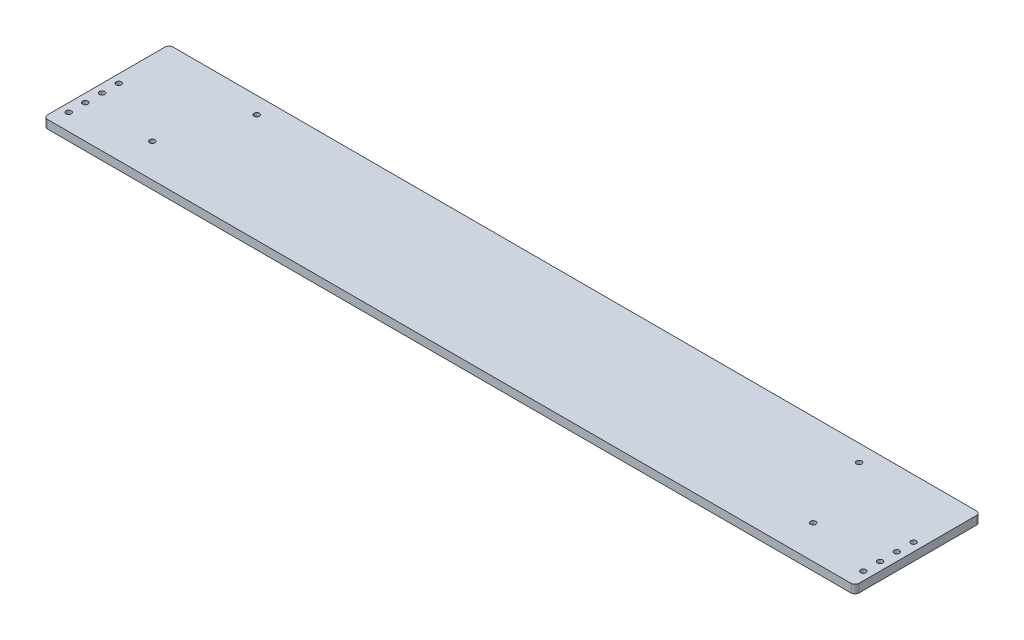
from build123d import *

# Parameters (mm, degrees)
SKETCH1_W           = 615.95
SKETCH1_H           = 95.25
SKETCH1_R           = 2.0193
BOSS_EXTRUDE1_DEPTH = 6.35
FILLET1_R           = 3.175
SKETCH2_R           = 2.0193
CUT_EXTRUDE1_DEPTH  = 312.700278713


with BuildPart() as part:
    # Sketch1 → Boss-Extrude1 (new body)
    with BuildSketch(Plane(origin=(0, 0, 0), x_dir=(1, 0, 0), z_dir=(0, 1, 0))):
        Rectangle(SKETCH1_W, SKETCH1_H)
        with Locations((-301.625, 3.175)):
            Circle(SKETCH1_R, mode=Mode.SUBTRACT)
        with Locations((-301.625, -9.525)):
            Circle(SKETCH1_R, mode=Mode.SUBTRACT)
        with Locations((-301.625, -22.225)):
            Circle(SKETCH1_R, mode=Mode.SUBTRACT)
        with Locations((-301.625, -34.925)):
            Circle(SKETCH1_R, mode=Mode.SUBTRACT)
        with Locations((301.625, -34.925)):
            Circle(SKETCH1_R, mode=Mode.SUBTRACT)
        with Locations((301.625, -22.225)):
            Circle(SKETCH1_R, mode=Mode.SUBTRACT)
        with Locations((301.625, -9.525)):
            Circle(SKETCH1_R, mode=Mode.SUBTRACT)
        with Locations((301.625, 3.175)):
            Circle(SKETCH1_R, mode=Mode.SUBTRACT)
    extrude(amount=BOSS_EXTRUDE1_DEPTH)

    # Fillet1
    fillet1_edges = [part.edges().sort_by_distance(p)[0] for p in [
        (307.975, 3.175, 47.625),
        (-307.975, 3.175, -47.625),
        (307.975, 3.175, -47.625),
        (-307.975, 3.175, 47.625),
    ]]
    fillet(fillet1_edges, radius=FILLET1_R)

    # Sketch2 → Cut-Extrude1 (cut, through all)
    with BuildSketch(Plane(origin=(0, 6.35, 0), x_dir=(1, 0, 0), z_dir=(0, 1, 0))):
        with Locations((-228.6, 34.925)):
            Circle(SKETCH2_R)
        with Locations((-250.825, -22.225)):
            Circle(SKETCH2_R)
        with Locations((250.825, -22.225)):
            Circle(SKETCH2_R)
        with Locations((228.6, 34.925)):
            Circle(SKETCH2_R)
    extrude(amount=-CUT_EXTRUDE1_DEPTH, mode=Mode.SUBTRACT)


solid = part.part
